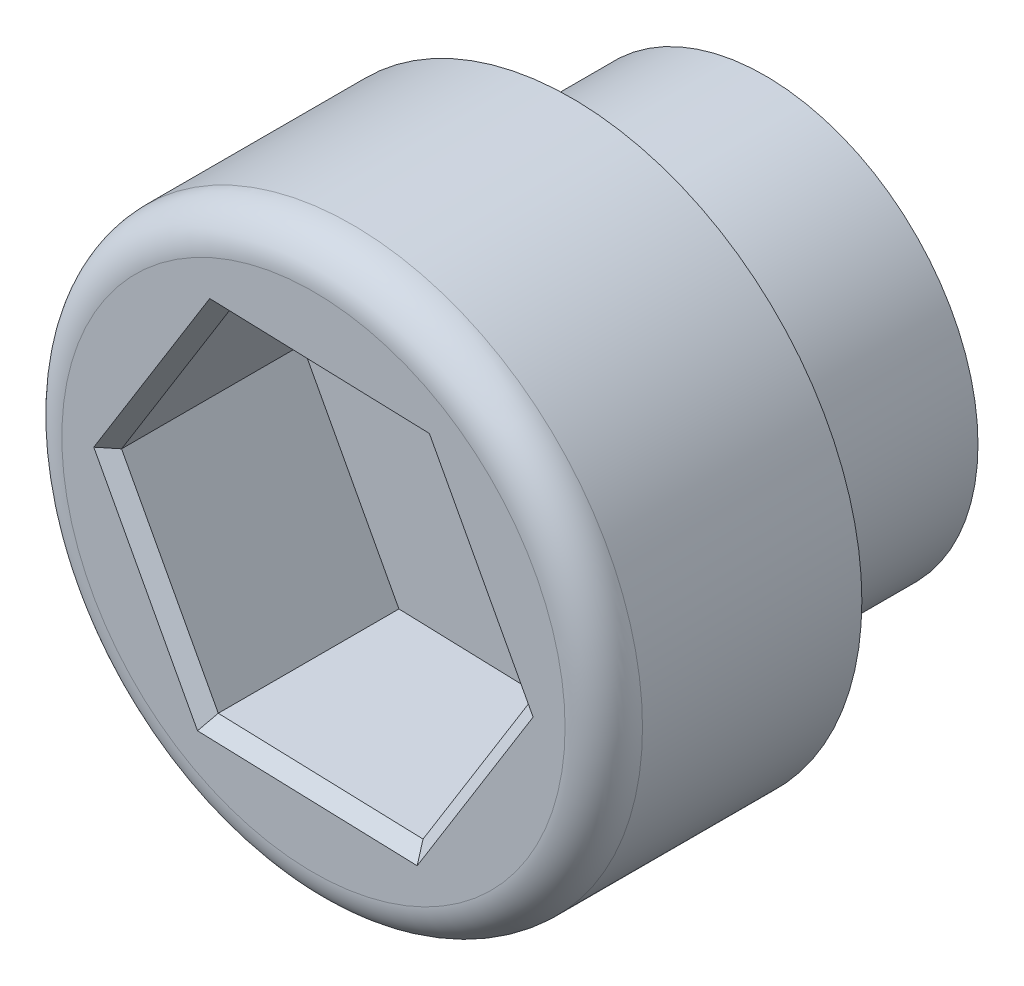
from build123d import *

# Parameters (mm, degrees)
SZKIC1_R                    = 3.3
DODANIE_WYCI_GNI_CIE1_DEPTH = 3
SZKIC2_R                    = 4.5
DODANIE_WYCI_GNI_CIE2_DEPTH = 4
WYTNIJ_WYCI_GNI_CIE1_DEPTH  = 3
ZAOKR_GLENIE1_R             = 0.6
SFAZOWANIE1_SIZE            = 0.2


with BuildPart() as part:
    # Szkic1 → Dodanie-wyciągnięcie1 (new body)
    with BuildSketch(Plane.XY):
        Circle(SZKIC1_R)
    extrude(amount=DODANIE_WYCI_GNI_CIE1_DEPTH)

    # Szkic2 → Dodanie-wyciągnięcie2 (add)
    with BuildSketch(Plane.XY.offset(3)):
        Circle(SZKIC2_R)
    extrude(amount=DODANIE_WYCI_GNI_CIE2_DEPTH)

    # Szkic3 → Wytnij-wyciągnięcie1 (cut)
    with BuildSketch(Plane.XY.offset(7)):
        Polygon((-1.498635565, 2.799540101), (-3.173790629, 0.101913581), (-1.675155064, -2.697626521), (1.498635565, -2.799540101), (3.173790629, -0.101913581), (1.675155064, 2.697626521), align=None)
    extrude(amount=-WYTNIJ_WYCI_GNI_CIE1_DEPTH, mode=Mode.SUBTRACT)

    # Zaokrąglenie1
    zaokr_glenie1_edges = [part.edges().sort_by_distance(p)[0] for p in [
        (-4.5, 0, 7),
    ]]
    fillet(zaokr_glenie1_edges, radius=ZAOKR_GLENIE1_R)

    # Sfazowanie1
    sfazowanie1_edges = [part.edges().sort_by_distance(p)[0] for p in [
        (-0.08825975, -2.748583311, 7),
        (-2.424472847, -1.29785647, 7),
        (-2.336213097, 1.450726841, 7),
        (0.08825975, 2.748583311, 7),
        (2.424472847, 1.29785647, 7),
        (2.336213097, -1.450726841, 7),
    ]]
    chamfer(sfazowanie1_edges, length=SFAZOWANIE1_SIZE)


solid = part.part
